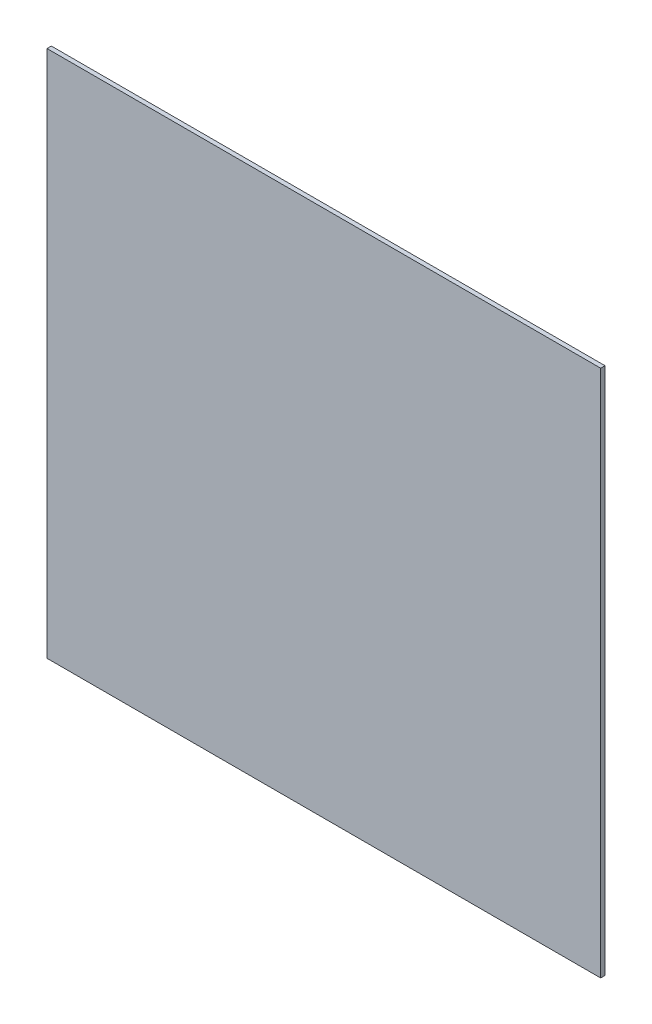
from build123d import *

# Parameters (mm, degrees)
SKETCH1_W           = 203.2
SKETCH1_H           = 193.802
BOSS_EXTRUDE1_DEPTH = 1.5875


with BuildPart() as part:
    # Sketch1 → Boss-Extrude1 (new body)
    with BuildSketch(Plane.XY):
        with Locations((101.6, 96.901)):
            Rectangle(SKETCH1_W, SKETCH1_H)
    extrude(amount=BOSS_EXTRUDE1_DEPTH)


solid = part.part
